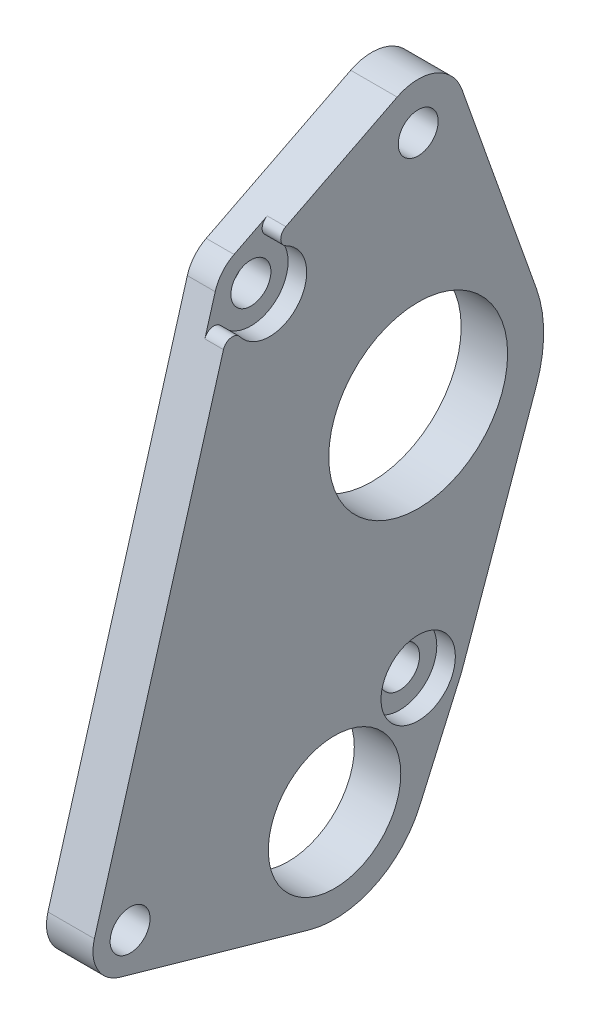
from build123d import *

# Parameters (mm, degrees)
SKETCH_1_R          = 2.15
SKETCH_1_R_2        = 7.125
EXTRUDE_1_DEPTH     = 5
EXTRUDE_START       = -5
SKETCH_2_R          = 13.5
SKETCH_2_R_2        = 9.5
EXTRUDE_2_DEPTH     = 5
CUT_EXTRUDE_START   = -2
SKETCH_3_R          = 4
CUT_EXTRUDE_1_DEPTH = 2
FILLET_START        = 3
FILLET_1_DEPTH      = 3
MOVE_FACE1_BY       = 0.125


with BuildPart() as part:
    # 草图1 → 凸台-拉伸1 (new body)
    with BuildSketch(Plane(origin=(0, 0, 0), x_dir=(0, 0, -1), z_dir=(1, 0, 0))):
        with BuildLine():
            Line((-23.090909091, -3.848365543), (-2.727272727, -9.620913858))
            ThreePointArc((-2.727272727, -9.620913858), (4.253098654, -9.050477989), (9.147283393, -4.040693817))
            Line((9.147283393, -4.040693817), (13.573641697, 5.979653091))
            ThreePointArc((13.573641697, 5.979653091), (13.638118854, 9.867579581), (10.897437667, 12.625984252))
            Line((10.897437667, 12.625984252), (1.979480632, 16.283858268))
            ThreePointArc((1.979480632, 16.283858268), (-9.5, 33.4), (1.979480632, 50.516141732))
            Line((1.979480632, 50.516141732), (10.897437667, 54.174015748))
            ThreePointArc((10.897437667, 54.174015748), (13.545928712, 60.881953925), (6.736898846, 63.258516924))
            Line((6.736898846, 63.258516924), (-8.810480924, 55.366813539))
            ThreePointArc((-8.810480924, 55.366813539), (-10.081211961, 54.350712224), (-10.842152772, 52.912592502))
            Line((-10.842152772, 52.912592502), (-25.842152772, 1.112592502))
            ThreePointArc((-25.842152772, 1.112592502), (-25.498078189, -1.939961078), (-23.090909091, -3.848365543))
        make_face()
        with Locations((9, 58.8)):
            Circle(SKETCH_1_R, mode=Mode.SUBTRACT)
        with Locations((-22, 0)):
            Circle(SKETCH_1_R, mode=Mode.SUBTRACT)
        with Locations((-7, 51.8)):
            Circle(SKETCH_1_R, mode=Mode.SUBTRACT)
        with Locations((9, 8)):
            Circle(SKETCH_1_R, mode=Mode.SUBTRACT)
        Circle(SKETCH_1_R_2, mode=Mode.SUBTRACT)
    extrude(amount=EXTRUDE_1_DEPTH)

    # 草图2 → 凸台-拉伸2 (add)
    # profile 1 of 2: a face of its own
    with BuildSketch(Plane(origin=(5, 0, 0), x_dir=(0, 0, -1), z_dir=(1, 0, 0)).offset(EXTRUDE_START)):
        with BuildLine():
            Line((21.721644442, 37.917716535), (13.711720164, 60.473228346))
            ThreePointArc((13.711720164, 60.473228346), (13.565113542, 56.760456337), (10.897437667, 54.174015748))
            Line((10.897437667, 54.174015748), (1.979480632, 50.516141732))
            ThreePointArc((1.979480632, 50.516141732), (-9.5, 33.4), (1.979480632, 16.283858268))
            Line((1.979480632, 16.283858268), (10.897437667, 12.625984252))
            ThreePointArc((10.897437667, 12.625984252), (13.565113542, 10.039543663), (13.711720164, 6.326771654))
            Line((13.711720164, 6.326771654), (21.721644442, 28.882283465))
            ThreePointArc((21.721644442, 28.882283465), (-4.5, 33.4), (21.721644442, 37.917716535))
        make_face()
    # profile 2 of 2: a face of its own
    with BuildSketch(Plane(origin=(5, 0, 0), x_dir=(0, 0, -1), z_dir=(1, 0, 0)).offset(EXTRUDE_START)):
        with Locations((9, 33.4)):
            Circle(SKETCH_2_R)
        with Locations((9, 33.4)):
            Circle(SKETCH_2_R_2, mode=Mode.SUBTRACT)
    extrude(amount=EXTRUDE_2_DEPTH)

    # 草图3 → 切除-拉伸1 (cut)
    with BuildSketch(Plane(origin=(5, 0, 0), x_dir=(0, 0, -1), z_dir=(1, 0, 0)).offset(CUT_EXTRUDE_START)):
        with Locations((-7, 51.8)):
            Circle(SKETCH_3_R)
        with Locations((9, 8)):
            Circle(SKETCH_3_R)
    extrude(amount=CUT_EXTRUDE_1_DEPTH, mode=Mode.SUBTRACT)

    # 圆角1: read off the stored shape, not the designer's step
    # 圆角1 outline → 圆角1 (cut)
    with BuildSketch(Plane.YZ.offset(FILLET_START)):
        with BuildLine():
            ThreePointArc((49.070439729, 11.954745274), (49.775814705, 11.174989574), (49.393833283, 10.195365665))
            ThreePointArc((49.393833283, 10.195365665), (51.07687003, 10.934092404), (52.912592502, 10.842152772))
            Line((52.912592502, 10.842152772), (49.070439729, 11.954745274))
        make_face()
        with BuildLine():
            ThreePointArc((55.388472863, 5.232837723), (56.279537114, 5.791028828), (57.177294463, 5.243667384))
            Line((57.177294463, 5.243667384), (55.366813539, 8.810480924))
            ThreePointArc((55.366813539, 8.810480924), (55.799926698, 7.02421586), (55.388472863, 5.232837723))
        make_face()
    extrude(amount=FILLET_1_DEPTH, mode=Mode.SUBTRACT)

    # Move Face1: a curved face moved inward by 0.125
    add(Solid.thicken(part.faces().sort_by_distance((2.5, 33.4, 0.5))[0], -MOVE_FACE1_BY), mode=Mode.SUBTRACT)


solid = part.part
